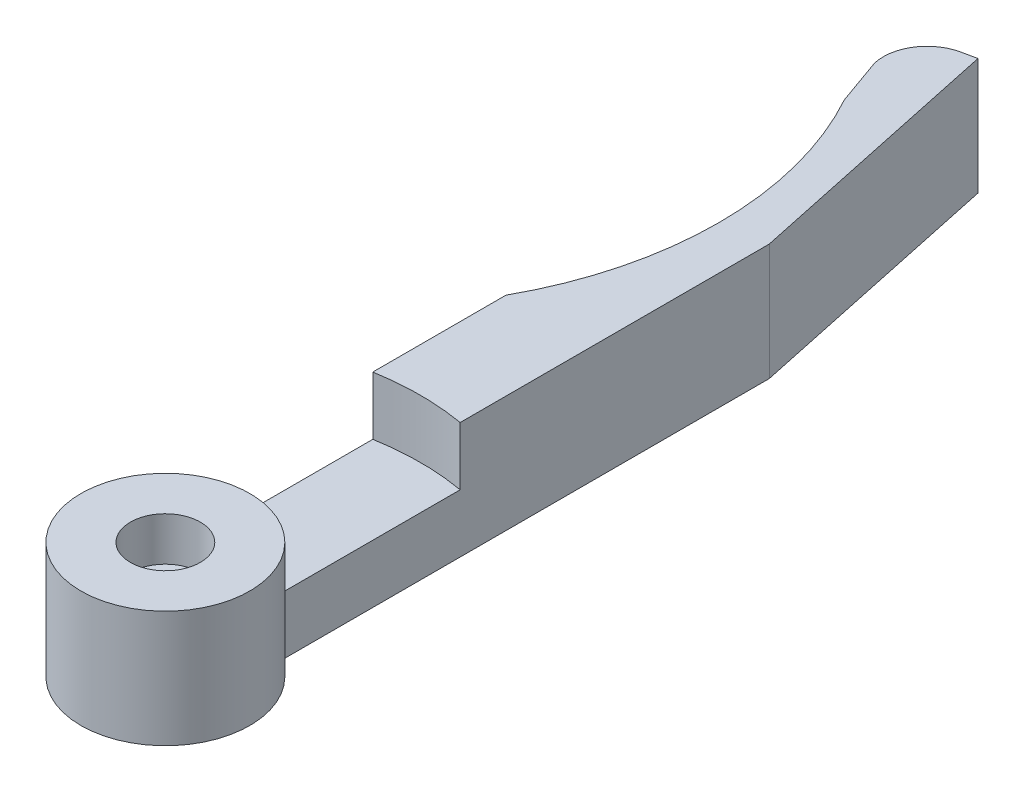
from build123d import *

# Parameters (mm, degrees)
BOSS_EXTRU_1_DEPTH      = 8
ESQUISSE2_R             = 2.4
ENL_V_MAT_EXTRU_1_DEPTH = 3
ENL_V_MAT_EXTRU_2_REACH = 59.173
ESQUISSE3_R             = 1.25
ESQUISSE4_R             = 3
ENL_V_MAT_EXTRU_3_DEPTH = 2
ENL_V_START             = -4
ENL_V_MAT_EXTRU_4_DEPTH = 4


with BuildPart() as part:
    # Esquisse1 → Boss.-Extru.1 (new body)
    with BuildSketch(Plane(origin=(0, 0, 0), x_dir=(1, 0, 0), z_dir=(0, 1, 0))):
        with BuildLine():
            Line((-3, 26.381049961), (-3, 4.963869458))
            ThreePointArc((-3, 4.963869458), (0, -5.8), (3, 4.963869458))
            Line((3, 4.963869458), (3, 38.463869458))
            Line((3, 38.463869458), (-0.867157449, 56.657414832))
            Line((-0.867157449, 56.657414832), (-1.84530505, 56.449503141))
            ThreePointArc((-1.84530505, 56.449503141), (-3.756758837, 55.119060789), (-4.140414176, 52.821988519))
            Line((-4.140414176, 52.821988519), (-3, 49.618950039))
            ThreePointArc((-3, 49.618950039), (0, 38), (-3, 26.381049961))
        make_face()
    extrude(amount=BOSS_EXTRU_1_DEPTH)

    # Esquisse2 → Enlèv. mat.-Extru.1 (cut)
    with BuildSketch(Plane(origin=(0, 8, 0), x_dir=(1, 0, 0), z_dir=(0, 1, 0))):
        Circle(ESQUISSE2_R)
    extrude(amount=-ENL_V_MAT_EXTRU_1_DEPTH, mode=Mode.SUBTRACT)

    # Esquisse3 → Enlèv. mat.-Extru.2 (cut, up to next)
    with BuildSketch(Plane(origin=(0, 5, 0), x_dir=(1, 0, 0), z_dir=(0, 1, 0)), mode=Mode.PRIVATE) as enl_v_mat_extru_2_sk1:
        Circle(ESQUISSE3_R)
    enl_v_mat_extru_2_tool1 = extrude(enl_v_mat_extru_2_sk1.sketch, amount=-ENL_V_MAT_EXTRU_2_REACH, mode=Mode.PRIVATE) & part.part
    add(enl_v_mat_extru_2_tool1.solids().sort_by_distance((0, 5, 0))[0], mode=Mode.SUBTRACT)

    # Esquisse4 → Enlèv. mat.-Extru.3 (cut)
    with BuildSketch(Plane.XZ):
        Circle(ESQUISSE4_R)
    extrude(amount=-ENL_V_MAT_EXTRU_3_DEPTH, mode=Mode.SUBTRACT)

    # Esquisse5 → Enlèv. mat.-Extru.4 (cut)
    with BuildSketch(Plane(origin=(0, 8, 0), x_dir=(1, 0, 0), z_dir=(0, 1, 0)).offset(ENL_V_START)):
        with BuildLine():
            Line((-3, 4.963869458), (-3, 17.24093965))
            ThreePointArc((-3, 17.24093965), (0, 17.5), (3, 17.24093965))
            Line((3, 17.24093965), (3, 4.963869458))
            ThreePointArc((3, 4.963869458), (0, 5.8), (-3, 4.963869458))
        make_face()
    extrude(amount=ENL_V_MAT_EXTRU_4_DEPTH, mode=Mode.SUBTRACT)


solid = part.part
